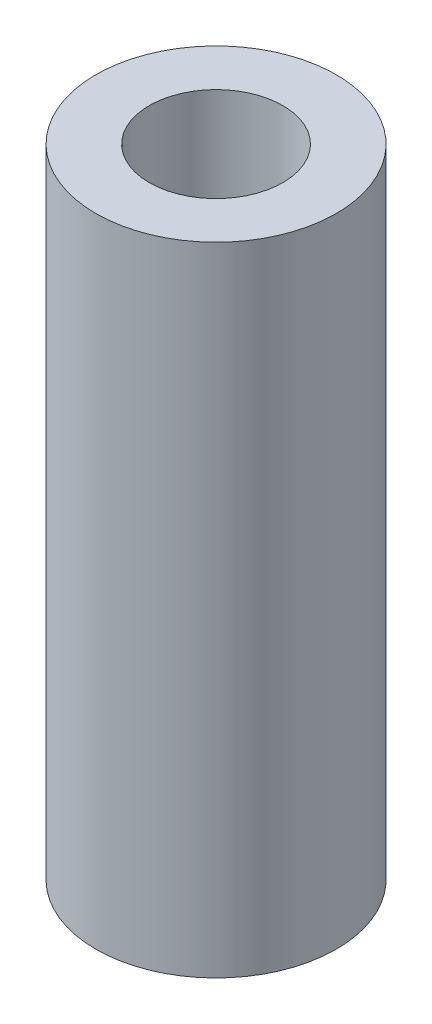
from build123d import *

# Parameters (mm, degrees)
SKETCH1_R           = 4.5
SKETCH1_R_2         = 2.5
BOSS_EXTRUDE1_DEPTH = 23.85


with BuildPart() as part:
    # Sketch1 → Boss-Extrude1 (new body)
    with BuildSketch(Plane(origin=(0, 0, 0), x_dir=(1, 0, 0), z_dir=(0, 1, 0))):
        Circle(SKETCH1_R)
        Circle(SKETCH1_R_2, mode=Mode.SUBTRACT)
    extrude(amount=BOSS_EXTRUDE1_DEPTH)


solid = part.part
